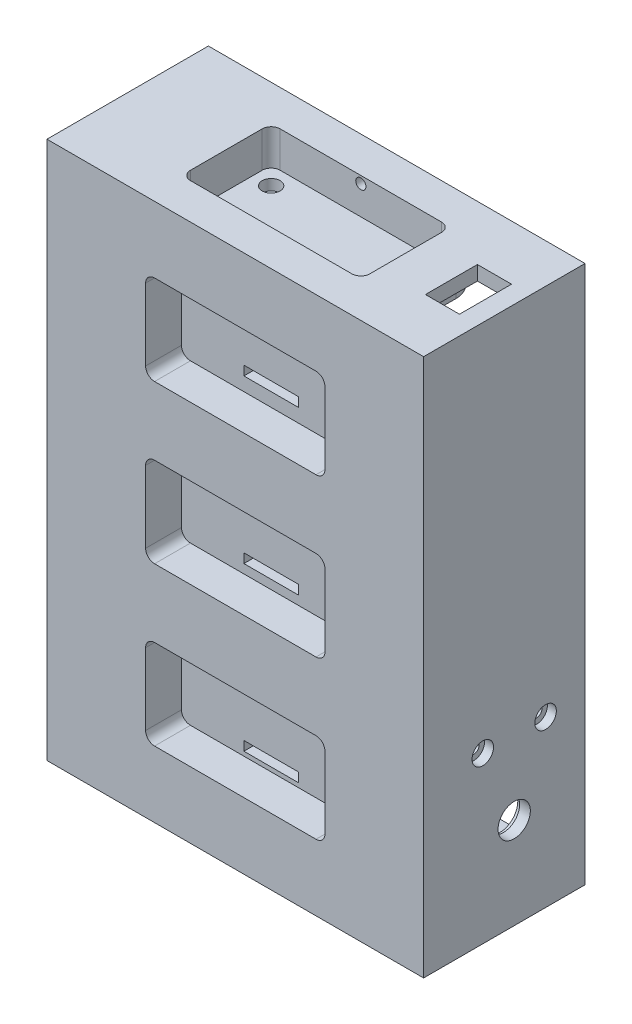
from build123d import *

# Parameters (mm, degrees)
SKETCH_1_W           = 105
SKETCH_1_H           = 150
EXTRUDE_1_DEPTH      = 45
CUT_EXTRUDE_1_DEPTH  = 10
CUT_EXTRUDE_2_DEPTH  = 10
SHELL_1_T            = -4
SKETCH_5_R           = 1.475
SKETCH_5_R_2         = 4.5
CUT_EXTRUDE_3_DEPTH  = 15
SKETCH_6_R           = 3
CUT_EXTRUDE_4_DEPTH  = 2.5
CUT_EXTRUDE_START    = -3
SKETCH_10_W          = 5
SKETCH_10_H          = 36.5
CUT_EXTRUDE_15_DEPTH = 100.655315425
SKETCH_11_R          = 5
CUT_EXTRUDE_16_DEPTH = 1
SKETCH_12_R          = 1.45
CUT_EXTRUDE_17_DEPTH = 10
SKETCH_13_R          = 1.45
CUT_EXTRUDE_18_DEPTH = 10
SKETCH_14_R          = 1.45
CUT_EXTRUDE_19_DEPTH = 3
SKETCH_15_R          = 2.5
SKETCH_15_W          = 15.2
SKETCH_15_H          = 2.6
CUT_EXTRUDE_20_DEPTH = 3
SKETCH_16_W          = 14
SKETCH_16_H          = 1.8
CUT_EXTRUDE_21_DEPTH = 3
SKETCH_17_R          = 2.5
SKETCH_17_W          = 15.2
SKETCH_17_H          = 2.6
CUT_EXTRUDE_22_DEPTH = 3
SKETCH_18_W          = 14
SKETCH_18_H          = 1.8
CUT_EXTRUDE_23_DEPTH = 3
SKETCH_19_R          = 2.5
SKETCH_19_W          = 15.2
SKETCH_19_H          = 2.6
CUT_EXTRUDE_24_DEPTH = 3
SKETCH_20_W          = 14
SKETCH_20_H          = 1.8
CUT_EXTRUDE_25_DEPTH = 3
SKETCH_21_W          = 9.5
SKETCH_21_H          = 14.5
CUT_EXTRUDE_26_DEPTH = 4
SKETCH_22_R          = 1.425
CUT_EXTRUDE_27_DEPTH = 10


with BuildPart() as part:
    # Эскиз1 → Бобышка-Вытянуть1 (new body)
    with BuildSketch(Plane.XY):
        Rectangle(SKETCH_1_W, SKETCH_1_H)
    extrude(amount=EXTRUDE_1_DEPTH)

    # Эскиз2 → Вырез-Вытянуть1 (cut)
    with BuildSketch(Plane.XZ.offset(75)):
        with BuildLine():
            Line((-22.5, 10), (22.5, 10))
            ThreePointArc((22.5, 10), (24.267766953, 10.732233047), (25, 12.5))
            Line((25, 12.5), (25, 32.5))
            ThreePointArc((25, 32.5), (24.267766953, 34.267766953), (22.5, 35))
            Line((22.5, 35), (-22.5, 35))
            ThreePointArc((-22.5, 35), (-24.267766953, 34.267766953), (-25, 32.5))
            Line((-25, 32.5), (-25, 12.5))
            ThreePointArc((-25, 12.5), (-24.267766953, 10.732233047), (-22.5, 10))
        make_face()
    cut_extrude_1 = extrude(amount=-CUT_EXTRUDE_1_DEPTH, mode=Mode.SUBTRACT)

    # Эскиз4 → Вырез-Вытянуть2 (cut)
    with BuildSketch(Plane.XY.offset(45)):
        with BuildLine():
            Line((-22.5, 31.5), (22.5, 31.5))
            ThreePointArc((22.5, 31.5), (24.267766953, 32.232233047), (25, 34))
            Line((25, 34), (25, 54))
            ThreePointArc((25, 54), (24.267766953, 55.767766953), (22.5, 56.5))
            Line((22.5, 56.5), (-22.5, 56.5))
            ThreePointArc((-22.5, 56.5), (-24.267766953, 55.767766953), (-25, 54))
            Line((-25, 54), (-25, 34))
            ThreePointArc((-25, 34), (-24.267766953, 32.232233047), (-22.5, 31.5))
        make_face()
        with BuildLine():
            Line((-22.5, -12.5), (22.5, -12.5))
            ThreePointArc((22.5, -12.5), (24.267766953, -11.767766953), (25, -10))
            Line((25, -10), (25, 10))
            ThreePointArc((25, 10), (24.267766953, 11.767766953), (22.5, 12.5))
            Line((22.5, 12.5), (-22.5, 12.5))
            ThreePointArc((-22.5, 12.5), (-24.267766953, 11.767766953), (-25, 10))
            Line((-25, 10), (-25, -10))
            ThreePointArc((-25, -10), (-24.267766953, -11.767766953), (-22.5, -12.5))
        make_face()
        with BuildLine():
            Line((-22.5, -56.5), (22.5, -56.5))
            ThreePointArc((22.5, -56.5), (24.267766953, -55.767766953), (25, -54))
            Line((25, -54), (25, -34))
            ThreePointArc((25, -34), (24.267766953, -32.232233047), (22.5, -31.5))
            Line((22.5, -31.5), (-22.5, -31.5))
            ThreePointArc((-22.5, -31.5), (-24.267766953, -32.232233047), (-25, -34))
            Line((-25, -34), (-25, -54))
            ThreePointArc((-25, -54), (-24.267766953, -55.767766953), (-22.5, -56.5))
        make_face()
    extrude(amount=-CUT_EXTRUDE_2_DEPTH, mode=Mode.SUBTRACT)

    # Зеркальное отражение1: Вырез-Вытянуть1 across plane
    add(cut_extrude_1.mirror(Plane.ZX), mode=Mode.SUBTRACT)

    # Оболочка1
    shell_1_openings = [part.faces().sort_by_distance(p)[0] for p in [
        (0, 0, 0),
    ]]
    offset(amount=SHELL_1_T, openings=shell_1_openings, kind=Kind.INTERSECTION)

    # Эскиз5 → Вырез-Вытянуть3 (cut)
    with BuildSketch(Plane.ZY.offset(52.5)):
        with Locations((11, -29)):
            Circle(SKETCH_5_R)
        with Locations((28.5, -29)):
            Circle(SKETCH_5_R)
        with Locations((19.75, -49.5)):
            Circle(SKETCH_5_R_2)
    cut_extrude_3 = extrude(amount=-CUT_EXTRUDE_3_DEPTH, mode=Mode.SUBTRACT)

    # Эскиз6 → Вырез-Вытянуть4 (cut)
    with BuildSketch(Plane.ZY.offset(52.5)):
        with Locations((11, -29)):
            Circle(SKETCH_6_R)
        with Locations((28.5, -29)):
            Circle(SKETCH_6_R)
    cut_extrude_4 = extrude(amount=-CUT_EXTRUDE_4_DEPTH, mode=Mode.SUBTRACT)

    # Эскиз10 → Вырез-Вытянуть15 (cut)
    with BuildSketch(Plane(origin=(0, 0, 31), x_dir=(-1, 0, 0), z_dir=(0, 0, -1)).offset(CUT_EXTRUDE_START)):
        with Locations((23.5, -45.75)):
            Rectangle(SKETCH_10_W, SKETCH_10_H)
    cut_extrude_15 = extrude(amount=CUT_EXTRUDE_15_DEPTH, mode=Mode.SUBTRACT)

    # Эскиз11 → Вырез-Вытянуть16 (cut)
    with BuildSketch(Plane(origin=(-48.5, 0, 0), x_dir=(0, 0, -1), z_dir=(1, 0, 0))):
        with Locations((-19.75, -49.5)):
            Circle(SKETCH_11_R)
    cut_extrude_16 = extrude(amount=-CUT_EXTRUDE_16_DEPTH, mode=Mode.SUBTRACT)

    # Зеркальное отражение2: Вырез-Вытянуть3, Вырез-Вытянуть4, Вырез-Вытянуть15, Вырез-Вытянуть16 across plane
    add(cut_extrude_3.mirror(Plane(origin=(0, 0, 0), x_dir=(0, 0, 1), z_dir=(1, 0, 0))), mode=Mode.SUBTRACT)
    add(cut_extrude_4.mirror(Plane(origin=(0, 0, 0), x_dir=(0, 0, 1), z_dir=(1, 0, 0))), mode=Mode.SUBTRACT)
    add(cut_extrude_15.mirror(Plane(origin=(0, 0, 0), x_dir=(0, 0, 1), z_dir=(1, 0, 0))), mode=Mode.SUBTRACT)
    add(cut_extrude_16.mirror(Plane(origin=(0, 0, 0), x_dir=(0, 0, 1), z_dir=(1, 0, 0))), mode=Mode.SUBTRACT)

    # Эскиз12 → Вырез-Вытянуть17 (cut)
    with BuildSketch(Plane(origin=(0, 0, 6), x_dir=(-1, 0, 0), z_dir=(0, 0, -1))):
        with Locations((-10, -63)):
            Circle(SKETCH_12_R)
        with Locations((10, -63)):
            Circle(SKETCH_12_R)
    extrude(amount=-CUT_EXTRUDE_17_DEPTH, mode=Mode.SUBTRACT)

    # Эскиз13 → Вырез-Вытянуть18 (cut)
    with BuildSketch(Plane(origin=(0, 0, 31), x_dir=(-1, 0, 0), z_dir=(0, 0, -1))):
        with Locations((-9, -29.5)):
            Circle(SKETCH_13_R)
        with Locations((9, -29.5)):
            Circle(SKETCH_13_R)
    extrude(amount=-CUT_EXTRUDE_18_DEPTH, mode=Mode.SUBTRACT)

    # Эскиз14 → Вырез-Вытянуть19 (cut)
    with BuildSketch(Plane(origin=(0, 0, 31), x_dir=(-1, 0, 0), z_dir=(0, 0, -1))):
        with Locations((20, 48.5)):
            Circle(SKETCH_14_R)
        with Locations((20, -6.5)):
            Circle(SKETCH_14_R)
        with Locations((-20, -6.5)):
            Circle(SKETCH_14_R)
        with Locations((-20, 48.5)):
            Circle(SKETCH_14_R)
    extrude(amount=-CUT_EXTRUDE_19_DEPTH, mode=Mode.SUBTRACT)

    # Эскиз15 → Вырез-Вытянуть20 (cut)
    with BuildSketch(Plane.XY.offset(35)):
        with Locations((-20, -36.5)):
            Circle(SKETCH_15_R)
        with Locations((20, -36.5)):
            Circle(SKETCH_15_R)
        with Locations((-20, 7.5)):
            Circle(SKETCH_15_R)
        with Locations((20, 7.5)):
            Circle(SKETCH_15_R)
        with Locations((-20, 51.5)):
            Circle(SKETCH_15_R)
        with Locations((20, 51.5)):
            Circle(SKETCH_15_R)
        with Locations((0, -54)):
            Rectangle(SKETCH_15_W, SKETCH_15_H)
        with Locations((0, -8.7)):
            Rectangle(SKETCH_15_W, SKETCH_15_H)
        with Locations((0, 36.6)):
            Rectangle(SKETCH_15_W, SKETCH_15_H)
    extrude(amount=-CUT_EXTRUDE_20_DEPTH, mode=Mode.SUBTRACT)

    # Эскиз16 → Вырез-Вытянуть21 (cut)
    with BuildSketch(Plane.XY.offset(32)):
        with Locations((0, -54)):
            Rectangle(SKETCH_16_W, SKETCH_16_H)
        with Locations((0, -8.7)):
            Rectangle(SKETCH_16_W, SKETCH_16_H)
        with Locations((0, 36.6)):
            Rectangle(SKETCH_16_W, SKETCH_16_H)
    extrude(amount=-CUT_EXTRUDE_21_DEPTH, mode=Mode.SUBTRACT)

    # Эскиз17 → Вырез-Вытянуть22 (cut)
    with BuildSketch(Plane.XZ.offset(65)):
        with Locations((-20, 30)):
            Circle(SKETCH_17_R)
        with Locations((20, 30)):
            Circle(SKETCH_17_R)
        with Locations((0, 13.8)):
            Rectangle(SKETCH_17_W, SKETCH_17_H)
    extrude(amount=-CUT_EXTRUDE_22_DEPTH, mode=Mode.SUBTRACT)

    # Эскиз18 → Вырез-Вытянуть23 (cut)
    with BuildSketch(Plane.XZ.offset(62)):
        with Locations((0, 13.8)):
            Rectangle(SKETCH_18_W, SKETCH_18_H)
    extrude(amount=-CUT_EXTRUDE_23_DEPTH, mode=Mode.SUBTRACT)

    # Эскиз19 → Вырез-Вытянуть24 (cut)
    with BuildSketch(Plane(origin=(0, 65, 0), x_dir=(1, 0, 0), z_dir=(0, 1, 0))):
        with Locations((-20, -15)):
            Circle(SKETCH_19_R)
        with Locations((20, -15)):
            Circle(SKETCH_19_R)
        with Locations((0, -31.2)):
            Rectangle(SKETCH_19_W, SKETCH_19_H)
    extrude(amount=-CUT_EXTRUDE_24_DEPTH, mode=Mode.SUBTRACT)

    # Эскиз20 → Вырез-Вытянуть25 (cut)
    with BuildSketch(Plane(origin=(0, 62, 0), x_dir=(1, 0, 0), z_dir=(0, 1, 0))):
        with Locations((0, -31.2)):
            Rectangle(SKETCH_20_W, SKETCH_20_H)
    extrude(amount=-CUT_EXTRUDE_25_DEPTH, mode=Mode.SUBTRACT)

    # Эскиз21 → Вырез-Вытянуть26 (cut)
    with BuildSketch(Plane(origin=(0, 75, 0), x_dir=(1, 0, 0), z_dir=(0, 1, 0))):
        with Locations((42.5, -22.5)):
            Rectangle(SKETCH_21_W, SKETCH_21_H)
    extrude(amount=-CUT_EXTRUDE_26_DEPTH, mode=Mode.SUBTRACT)

    # Эскиз22 → Вырез-Вытянуть27 (cut)
    with BuildSketch(Plane(origin=(0, 0, 0), x_dir=(-1, 0, 0), z_dir=(0, 0, -1))):
        with Locations((-50.5, -73)):
            Circle(SKETCH_22_R)
        with Locations((-50.5, 73)):
            Circle(SKETCH_22_R)
        with Locations((50.5, 73)):
            Circle(SKETCH_22_R)
        with Locations((50.5, -73)):
            Circle(SKETCH_22_R)
        with Locations((0, 73)):
            Circle(SKETCH_22_R)
        with Locations((0, -73)):
            Circle(SKETCH_22_R)
        with Locations((-50.5, 0)):
            Circle(SKETCH_22_R)
        with Locations((50.5, 0)):
            Circle(SKETCH_22_R)
    extrude(amount=-CUT_EXTRUDE_27_DEPTH, mode=Mode.SUBTRACT)


solid = part.part
